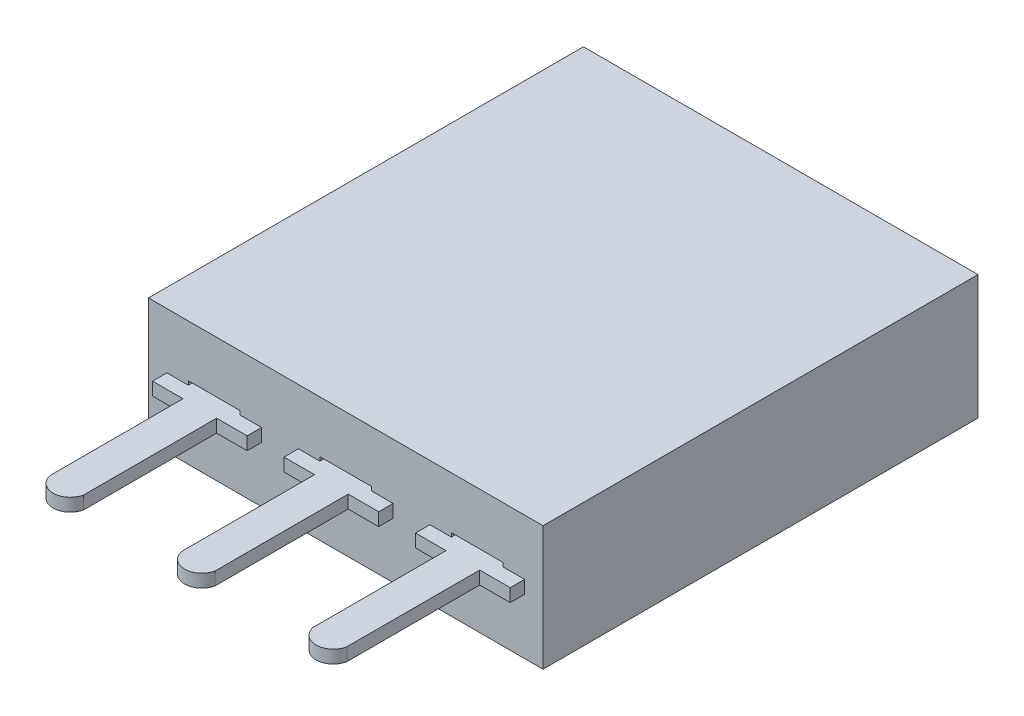
from build123d import *

# Parameters (mm, degrees)
SKETCH1_W               = 2.54
SKETCH1_H               = 2.4
SKETCH1_W_2             = 1.4
SKETCH1_H_2             = 1.45
BOSS_EXTRUDE1_DEPTH     = 4.2
BOSS_EXTRUDE3_START     = -1.2
BOSS_EXTRUDE3_DEPTH     = 0.125
LPATTERN1_START         = -0.125
LPATTERN1_DEPTH         = 0.25
LPATTERN1_2_DEPTH       = 0.25
LPATTERN1_START_2       = -4.2
LPATTERN1_3_OUTLINE_W   = 5.08
LPATTERN1_3_OUTLINE_H   = 2.4
LPATTERN1_3_OUTLINE_W_2 = 1.4
LPATTERN1_3_OUTLINE_H_2 = 1.45
LPATTERN1_3_DEPTH       = 8.4
SKETCH5_W               = 1.4
SKETCH5_H               = 1.45
SKETCH5_W_2             = 1
SKETCH5_H_2             = 0.4
BOSS_EXTRUDE4_DEPTH     = 8.4
LPATTERN2_COUNT         = 3
LPATTERN2_PITCH         = 2.54


# Read off the part's stored shape, not the designer's step: LPattern1
with BuildPart() as part:
    # Sketch1 → Boss-Extrude1 (new, symmetric)
    with BuildSketch(Plane.XY):
        Rectangle(SKETCH1_W, SKETCH1_H)
        Rectangle(SKETCH1_W_2, SKETCH1_H_2, mode=Mode.SUBTRACT)
    extrude(amount=BOSS_EXTRUDE1_DEPTH, both=True)

    # LPattern1 3 outline → LPattern1 3 (add)
    with BuildSketch(Plane.XY.offset(LPATTERN1_START_2)):
        with Locations((3.81, 0)):
            Rectangle(LPATTERN1_3_OUTLINE_W, LPATTERN1_3_OUTLINE_H)
        with Locations((2.54, 0)):
            Rectangle(LPATTERN1_3_OUTLINE_W_2, LPATTERN1_3_OUTLINE_H_2, mode=Mode.SUBTRACT)
        with Locations((5.08, 0)):
            Rectangle(LPATTERN1_3_OUTLINE_W_2, LPATTERN1_3_OUTLINE_H_2, mode=Mode.SUBTRACT)
    extrude(amount=LPATTERN1_3_DEPTH)

    # Sketch5 → Boss-Extrude4 (add)
    with BuildSketch(Plane(origin=(0, 0, -4.2), x_dir=(-1, 0, 0), z_dir=(0, 0, -1))):
        Rectangle(SKETCH5_W, SKETCH5_H)
        Rectangle(SKETCH5_W_2, SKETCH5_H_2, mode=Mode.SUBTRACT)
    boss_extrude4 = extrude(amount=-BOSS_EXTRUDE4_DEPTH)



with BuildPart() as body_2:
    # Sketch3 → Boss-Extrude3 (new, symmetric)
    with BuildSketch(Plane(origin=(0, 1.2, 0), x_dir=(1, 0, 0), z_dir=(0, 1, 0)).offset(BOSS_EXTRUDE3_START)):
        with BuildLine():
            Line((-0.914219602, -3.853355377), (-0.914219602, -4.477752268))
            Line((-0.914219602, -4.477752268), (-0.325, -4.477752268))
            Line((-0.325, -4.477752268), (-0.325, -7.045003795))
            ThreePointArc((-0.325, -7.045003795), (0, -7.311534777), (0.325, -7.045003795))
            Line((0.325, -7.045003795), (0.325, -4.477752268))
            Line((0.325, -4.477752268), (0.914219602, -4.477752268))
            Line((0.914219602, -4.477752268), (0.914219602, -3.853355377))
            Line((0.914219602, -3.853355377), (-0.914219602, -3.853355377))
        make_face()
    extrude(amount=BOSS_EXTRUDE3_DEPTH, both=True)


with BuildPart() as body_3:
    # LPattern1 outline → LPattern1 (new body)
    with BuildSketch(Plane(origin=(0, 0, 0), x_dir=(1, 0, 0), z_dir=(0, 1, 0)).offset(LPATTERN1_START)):
        with BuildLine():
            Line((3.454219602, -4.477752268), (3.454219602, -3.853355377))
            Line((3.454219602, -3.853355377), (1.625780398, -3.853355377))
            Line((1.625780398, -3.853355377), (1.625780398, -4.477752268))
            Line((1.625780398, -4.477752268), (2.215, -4.477752268))
            Line((2.215, -4.477752268), (2.215, -7.045003795))
            ThreePointArc((2.215, -7.045003795), (2.54, -7.311534777), (2.865, -7.045003795))
            Line((2.865, -7.045003795), (2.865, -4.477752268))
            Line((2.865, -4.477752268), (3.454219602, -4.477752268))
        make_face()
    extrude(amount=LPATTERN1_DEPTH)


with BuildPart() as body_4:
    # LPattern1 2 outline → LPattern1 2 (new body)
    with BuildSketch(Plane(origin=(0, 0, 0), x_dir=(1, 0, 0), z_dir=(0, 1, 0)).offset(LPATTERN1_START)):
        with BuildLine():
            Line((5.994219602, -4.477752268), (5.994219602, -3.853355377))
            Line((5.994219602, -3.853355377), (4.165780398, -3.853355377))
            Line((4.165780398, -3.853355377), (4.165780398, -4.477752268))
            Line((4.165780398, -4.477752268), (4.755, -4.477752268))
            Line((4.755, -4.477752268), (4.755, -7.045003795))
            ThreePointArc((4.755, -7.045003795), (5.08, -7.311534777), (5.405, -7.045003795))
            Line((5.405, -7.045003795), (5.405, -4.477752268))
            Line((5.405, -4.477752268), (5.994219602, -4.477752268))
        make_face()
    extrude(amount=LPATTERN1_2_DEPTH)


with BuildPart() as part_1:
    add(part.part)

    add(body_3.part)  # LPattern2 merges body 3

    add(body_4.part)  # LPattern2 merges body 4
    # LPattern2: Boss-Extrude4 ×3
    with Locations(*[(i * LPATTERN2_PITCH, 0, 0) for i in range(1, LPATTERN2_COUNT)]):
        add(boss_extrude4)


solid = Compound([body_2.part, part_1.part])
